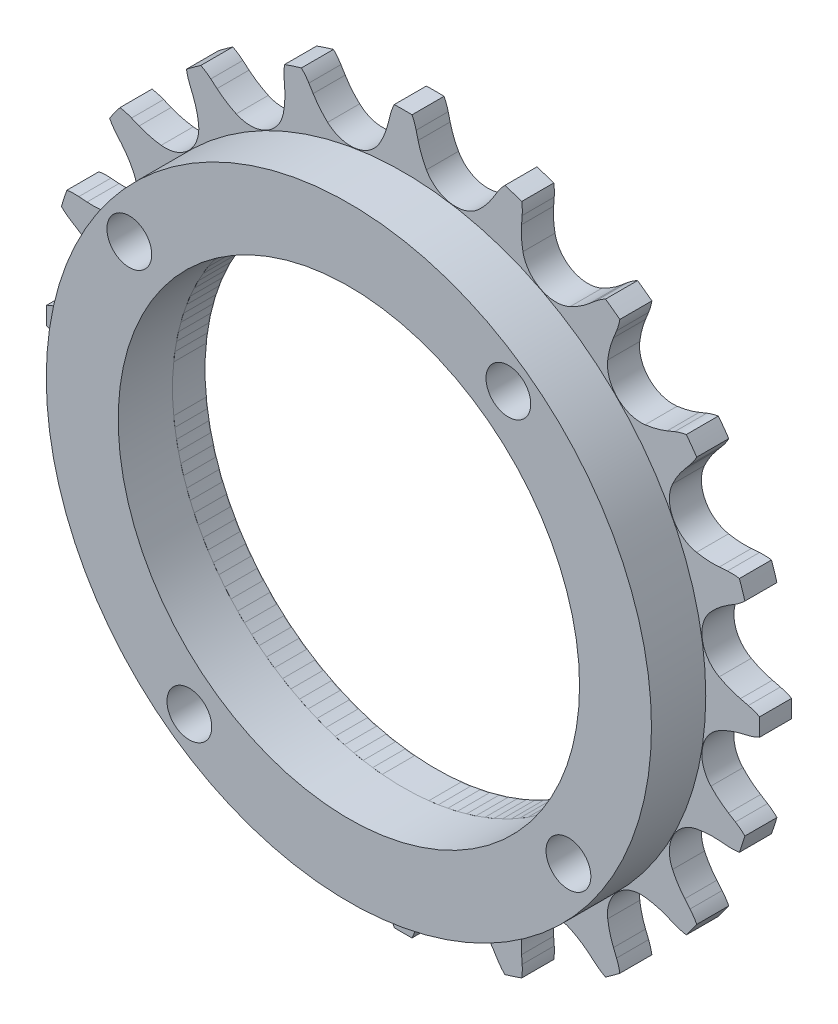
from build123d import *

# Parameters (mm, degrees)
SKETCH1_R           = 6.787119857
BOSS_EXTRUDE1_DEPTH = 2.3622
SKETCH2_R           = 18
BOSS_EXTRUDE2_DEPTH = 2.4
SKETCH3_R           = 17
CUT_EXTRUDE1_DEPTH  = 2.4
SKETCH6_R           = 22.300536673
SKETCH6_R_2         = 17
BOSS_EXTRUDE3_DEPTH = 4
SKETCH5_R           = 1.65
CUT_EXTRUDE3_DEPTH  = 38.700373301


with BuildPart() as part:
    # Sketch1 → Boss-Extrude1 (new body)
    with BuildSketch(Plane.XY.offset(0.25)):
        with BuildLine():
            Line((-24.488227524, 6.948596415), (-23.976513369, 6.631320197))
            ThreePointArc((-23.976513369, 6.631320197), (-23.291994454, 6.141252786), (-22.678303214, 5.564958353))
            ThreePointArc((-22.678303214, 5.564958353), (-22.044379306, 3.491486679), (-23.288014754, 1.715391192))
            ThreePointArc((-23.288014754, 1.715391192), (-24.04975458, 1.356943638), (-24.852209913, 1.102389812))
            Line((-24.852209913, 1.102389812), (-25.436922738, 0.958770568))
            ThreePointArc((-25.436922738, 0.958770568), (-25.860833079, 0.829247508), (-26.267723996, 0.653418098))
            ThreePointArc((-26.267723996, 0.653418098), (-26.275849732, 0), (-26.267723996, -0.653418098))
            ThreePointArc((-26.267723996, -0.653418098), (-25.860833079, -0.829247508), (-25.436922738, -0.958770568))
            Line((-25.436922738, -0.958770568), (-24.852209913, -1.102389812))
            ThreePointArc((-24.852209913, -1.102389812), (-24.04975458, -1.356943638), (-23.288014754, -1.715391192))
            ThreePointArc((-23.288014754, -1.715391192), (-22.044379306, -3.491486679), (-22.678303214, -5.564958353))
            ThreePointArc((-22.678303214, -5.564958353), (-23.291994454, -6.141252786), (-23.976513369, -6.631320197))
            Line((-23.976513369, -6.631320197), (-24.488227524, -6.948596415))
            ThreePointArc((-24.488227524, -6.948596415), (-24.851365389, -7.202775664), (-25.184007371, -7.495735579))
            ThreePointArc((-25.184007371, -7.495735579), (-24.989818108, -8.119684109), (-24.780172778, -8.738610658))
            ThreePointArc((-24.780172778, -8.738610658), (-24.338862244, -8.780098157), (-23.895674726, -8.772286407))
            Line((-23.895674726, -8.772286407), (-23.295198996, -8.728190226))
            ThreePointArc((-23.295198996, -8.728190226), (-22.453357164, -8.722312965), (-21.618133153, -8.827826296))
            ThreePointArc((-21.618133153, -8.827826296), (-19.886521867, -10.132688993), (-19.848681346, -12.300571001))
            ThreePointArc((-19.848681346, -12.300571001), (-20.254251625, -13.0383006), (-20.753828642, -13.715910381))
            Line((-20.753828642, -13.715910381), (-21.14245398, -14.175786366))
            ThreePointArc((-21.14245398, -14.175786366), (-21.409272906, -14.529740969), (-21.635104637, -14.911154431))
            ThreePointArc((-21.635104637, -14.911154431), (-21.257608974, -15.444556964), (-20.866965595, -15.968407121))
            ThreePointArc((-20.866965595, -15.968407121), (-20.434433994, -15.871491623), (-20.01535158, -15.727109732))
            Line((-20.01535158, -15.727109732), (-19.457891694, -15.499614567))
            ThreePointArc((-19.457891694, -15.499614567), (-18.659068707, -15.233881527), (-17.832118057, -15.076132254))
            ThreePointArc((-17.832118057, -15.076132254), (-15.782033111, -15.782033111), (-15.076132254, -17.832118057))
            ThreePointArc((-15.076132254, -17.832118057), (-15.233881527, -18.659068707), (-15.499614567, -19.457891694))
            Line((-15.499614567, -19.457891694), (-15.727109732, -20.01535158))
            ThreePointArc((-15.727109732, -20.01535158), (-15.871491623, -20.434433994), (-15.968407121, -20.866965595))
            ThreePointArc((-15.968407121, -20.866965595), (-15.444556964, -21.257608974), (-14.911154431, -21.635104637))
            ThreePointArc((-14.911154431, -21.635104637), (-14.529740969, -21.409272906), (-14.175786366, -21.14245398))
            Line((-14.175786366, -21.14245398), (-13.715910381, -20.753828642))
            ThreePointArc((-13.715910381, -20.753828642), (-13.0383006, -20.254251625), (-12.300571001, -19.848681346))
            ThreePointArc((-12.300571001, -19.848681346), (-10.132688993, -19.886521867), (-8.827826296, -21.618133153))
            ThreePointArc((-8.827826296, -21.618133153), (-8.722312965, -22.453357164), (-8.728190226, -23.295198996))
            Line((-8.728190226, -23.295198996), (-8.772286407, -23.895674726))
            ThreePointArc((-8.772286407, -23.895674726), (-8.780098157, -24.338862244), (-8.738610658, -24.780172778))
            ThreePointArc((-8.738610658, -24.780172778), (-8.119684109, -24.989818108), (-7.495735579, -25.184007371))
            ThreePointArc((-7.495735579, -25.184007371), (-7.202775664, -24.851365389), (-6.948596415, -24.488227524))
            Line((-6.948596415, -24.488227524), (-6.631320197, -23.976513369))
            ThreePointArc((-6.631320197, -23.976513369), (-6.141252786, -23.291994454), (-5.564958353, -22.678303214))
            ThreePointArc((-5.564958353, -22.678303214), (-3.491486679, -22.044379306), (-1.715391192, -23.288014754))
            ThreePointArc((-1.715391192, -23.288014754), (-1.356943638, -24.04975458), (-1.102389812, -24.852209913))
            Line((-1.102389812, -24.852209913), (-0.958770568, -25.436922738))
            ThreePointArc((-0.958770568, -25.436922738), (-0.829247508, -25.860833079), (-0.653418098, -26.267723996))
            ThreePointArc((-0.653418098, -26.267723996), (0, -26.275849732), (0.653418098, -26.267723996))
            ThreePointArc((0.653418098, -26.267723996), (0.829247508, -25.860833079), (0.958770568, -25.436922738))
            Line((0.958770568, -25.436922738), (1.102389812, -24.852209913))
            ThreePointArc((1.102389812, -24.852209913), (1.356943638, -24.04975458), (1.715391192, -23.288014754))
            ThreePointArc((1.715391192, -23.288014754), (3.491486679, -22.044379306), (5.564958353, -22.678303214))
            ThreePointArc((5.564958353, -22.678303214), (6.141252786, -23.291994454), (6.631320197, -23.976513369))
            Line((6.631320197, -23.976513369), (6.948596415, -24.488227524))
            ThreePointArc((6.948596415, -24.488227524), (7.202775664, -24.851365389), (7.495735579, -25.184007371))
            ThreePointArc((7.495735579, -25.184007371), (8.119684109, -24.989818108), (8.738610658, -24.780172778))
            ThreePointArc((8.738610658, -24.780172778), (8.780098157, -24.338862244), (8.772286407, -23.895674726))
            Line((8.772286407, -23.895674726), (8.728190226, -23.295198996))
            ThreePointArc((8.728190226, -23.295198996), (8.722312965, -22.453357164), (8.827826296, -21.618133153))
            ThreePointArc((8.827826296, -21.618133153), (10.132688993, -19.886521867), (12.300571001, -19.848681346))
            ThreePointArc((12.300571001, -19.848681346), (13.0383006, -20.254251625), (13.715910381, -20.753828642))
            Line((13.715910381, -20.753828642), (14.175786366, -21.14245398))
            ThreePointArc((14.175786366, -21.14245398), (14.529740969, -21.409272906), (14.911154431, -21.635104637))
            ThreePointArc((14.911154431, -21.635104637), (15.444556964, -21.257608974), (15.968407121, -20.866965595))
            ThreePointArc((15.968407121, -20.866965595), (15.871491623, -20.434433994), (15.727109732, -20.01535158))
            Line((15.727109732, -20.01535158), (15.499614567, -19.457891694))
            ThreePointArc((15.499614567, -19.457891694), (15.233881527, -18.659068707), (15.076132254, -17.832118057))
            ThreePointArc((15.076132254, -17.832118057), (15.782033111, -15.782033111), (17.832118057, -15.076132254))
            ThreePointArc((17.832118057, -15.076132254), (18.659068707, -15.233881527), (19.457891694, -15.499614567))
            Line((19.457891694, -15.499614567), (20.01535158, -15.727109732))
            ThreePointArc((20.01535158, -15.727109732), (20.434433994, -15.871491623), (20.866965595, -15.968407121))
            ThreePointArc((20.866965595, -15.968407121), (21.257608974, -15.444556964), (21.635104637, -14.911154431))
            ThreePointArc((21.635104637, -14.911154431), (21.409272906, -14.529740969), (21.14245398, -14.175786366))
            Line((21.14245398, -14.175786366), (20.753828642, -13.715910381))
            ThreePointArc((20.753828642, -13.715910381), (20.254251625, -13.0383006), (19.848681346, -12.300571001))
            ThreePointArc((19.848681346, -12.300571001), (19.886521867, -10.132688993), (21.618133153, -8.827826296))
            ThreePointArc((21.618133153, -8.827826296), (22.453357164, -8.722312965), (23.295198996, -8.728190226))
            Line((23.295198996, -8.728190226), (23.895674726, -8.772286407))
            ThreePointArc((23.895674726, -8.772286407), (24.338862244, -8.780098157), (24.780172778, -8.738610658))
            ThreePointArc((24.780172778, -8.738610658), (24.989818108, -8.119684109), (25.184007371, -7.495735579))
            ThreePointArc((25.184007371, -7.495735579), (24.851365389, -7.202775664), (24.488227524, -6.948596415))
            Line((24.488227524, -6.948596415), (23.976513369, -6.631320197))
            ThreePointArc((23.976513369, -6.631320197), (23.291994454, -6.141252786), (22.678303214, -5.564958353))
            ThreePointArc((22.678303214, -5.564958353), (22.044379306, -3.491486679), (23.288014754, -1.715391192))
            ThreePointArc((23.288014754, -1.715391192), (24.04975458, -1.356943638), (24.852209913, -1.102389812))
            Line((24.852209913, -1.102389812), (25.436922738, -0.958770568))
            ThreePointArc((25.436922738, -0.958770568), (25.860833079, -0.829247508), (26.267723996, -0.653418098))
            ThreePointArc((26.267723996, -0.653418098), (26.275849732, 0), (26.267723996, 0.653418098))
            ThreePointArc((26.267723996, 0.653418098), (25.860833079, 0.829247508), (25.436922738, 0.958770568))
            Line((25.436922738, 0.958770568), (24.852209913, 1.102389812))
            ThreePointArc((24.852209913, 1.102389812), (24.04975458, 1.356943638), (23.288014754, 1.715391192))
            ThreePointArc((23.288014754, 1.715391192), (22.044379306, 3.491486679), (22.678303214, 5.564958353))
            ThreePointArc((22.678303214, 5.564958353), (23.291994454, 6.141252786), (23.976513369, 6.631320197))
            Line((23.976513369, 6.631320197), (24.488227524, 6.948596415))
            ThreePointArc((24.488227524, 6.948596415), (24.851365389, 7.202775664), (25.184007371, 7.495735579))
            ThreePointArc((25.184007371, 7.495735579), (24.989818108, 8.119684109), (24.780172778, 8.738610658))
            ThreePointArc((24.780172778, 8.738610658), (24.338862244, 8.780098157), (23.895674726, 8.772286407))
            Line((23.895674726, 8.772286407), (23.295198996, 8.728190226))
            ThreePointArc((23.295198996, 8.728190226), (22.453357164, 8.722312965), (21.618133153, 8.827826296))
            ThreePointArc((21.618133153, 8.827826296), (19.886521867, 10.132688993), (19.848681346, 12.300571001))
            ThreePointArc((19.848681346, 12.300571001), (20.254251625, 13.0383006), (20.753828642, 13.715910381))
            Line((20.753828642, 13.715910381), (21.14245398, 14.175786366))
            ThreePointArc((21.14245398, 14.175786366), (21.409272906, 14.529740969), (21.635104637, 14.911154431))
            ThreePointArc((21.635104637, 14.911154431), (21.257608974, 15.444556964), (20.866965595, 15.968407121))
            ThreePointArc((20.866965595, 15.968407121), (20.434433994, 15.871491623), (20.01535158, 15.727109732))
            Line((20.01535158, 15.727109732), (19.457891694, 15.499614567))
            ThreePointArc((19.457891694, 15.499614567), (18.659068707, 15.233881527), (17.832118057, 15.076132254))
            ThreePointArc((17.832118057, 15.076132254), (15.782033111, 15.782033111), (15.076132254, 17.832118057))
            ThreePointArc((15.076132254, 17.832118057), (15.233881527, 18.659068707), (15.499614567, 19.457891694))
            Line((15.499614567, 19.457891694), (15.727109732, 20.01535158))
            ThreePointArc((15.727109732, 20.01535158), (15.871491623, 20.434433994), (15.968407121, 20.866965595))
            ThreePointArc((15.968407121, 20.866965595), (15.444556964, 21.257608974), (14.911154431, 21.635104637))
            ThreePointArc((14.911154431, 21.635104637), (14.529740969, 21.409272906), (14.175786366, 21.14245398))
            Line((14.175786366, 21.14245398), (13.715910381, 20.753828642))
            ThreePointArc((13.715910381, 20.753828642), (13.0383006, 20.254251625), (12.300571001, 19.848681346))
            ThreePointArc((12.300571001, 19.848681346), (10.132688993, 19.886521867), (8.827826296, 21.618133153))
            ThreePointArc((8.827826296, 21.618133153), (8.722312965, 22.453357164), (8.728190226, 23.295198996))
            Line((8.728190226, 23.295198996), (8.772286407, 23.895674726))
            ThreePointArc((8.772286407, 23.895674726), (8.780098157, 24.338862244), (8.738610658, 24.780172778))
            ThreePointArc((8.738610658, 24.780172778), (8.119684109, 24.989818108), (7.495735579, 25.184007371))
            ThreePointArc((7.495735579, 25.184007371), (7.202775664, 24.851365389), (6.948596415, 24.488227524))
            Line((6.948596415, 24.488227524), (6.631320197, 23.976513369))
            ThreePointArc((6.631320197, 23.976513369), (6.141252786, 23.291994454), (5.564958353, 22.678303214))
            ThreePointArc((5.564958353, 22.678303214), (3.491486679, 22.044379306), (1.715391192, 23.288014754))
            ThreePointArc((1.715391192, 23.288014754), (1.356943638, 24.04975458), (1.102389812, 24.852209913))
            Line((1.102389812, 24.852209913), (0.958770568, 25.436922738))
            ThreePointArc((0.958770568, 25.436922738), (0.829247508, 25.860833079), (0.653418098, 26.267723996))
            ThreePointArc((0.653418098, 26.267723996), (0, 26.275849732), (-0.653418098, 26.267723996))
            ThreePointArc((-0.653418098, 26.267723996), (-0.829247508, 25.860833079), (-0.958770568, 25.436922738))
            Line((-0.958770568, 25.436922738), (-1.102389812, 24.852209913))
            ThreePointArc((-1.102389812, 24.852209913), (-1.356943638, 24.04975458), (-1.715391192, 23.288014754))
            ThreePointArc((-1.715391192, 23.288014754), (-3.491486679, 22.044379306), (-5.564958353, 22.678303214))
            ThreePointArc((-5.564958353, 22.678303214), (-6.141252786, 23.291994454), (-6.631320197, 23.976513369))
            Line((-6.631320197, 23.976513369), (-6.948596415, 24.488227524))
            ThreePointArc((-6.948596415, 24.488227524), (-7.202775664, 24.851365389), (-7.495735579, 25.184007371))
            ThreePointArc((-7.495735579, 25.184007371), (-8.119684109, 24.989818108), (-8.738610658, 24.780172778))
            ThreePointArc((-8.738610658, 24.780172778), (-8.780098157, 24.338862244), (-8.772286407, 23.895674726))
            Line((-8.772286407, 23.895674726), (-8.728190226, 23.295198996))
            ThreePointArc((-8.728190226, 23.295198996), (-8.722312965, 22.453357164), (-8.827826296, 21.618133153))
            ThreePointArc((-8.827826296, 21.618133153), (-10.132688993, 19.886521867), (-12.300571001, 19.848681346))
            ThreePointArc((-12.300571001, 19.848681346), (-13.0383006, 20.254251625), (-13.715910381, 20.753828642))
            Line((-13.715910381, 20.753828642), (-14.175786366, 21.14245398))
            ThreePointArc((-14.175786366, 21.14245398), (-14.529740969, 21.409272906), (-14.911154431, 21.635104637))
            ThreePointArc((-14.911154431, 21.635104637), (-15.444556964, 21.257608974), (-15.968407121, 20.866965595))
            ThreePointArc((-15.968407121, 20.866965595), (-15.871491623, 20.434433994), (-15.727109732, 20.01535158))
            Line((-15.727109732, 20.01535158), (-15.499614567, 19.457891694))
            ThreePointArc((-15.499614567, 19.457891694), (-15.233881527, 18.659068707), (-15.076132254, 17.832118057))
            ThreePointArc((-15.076132254, 17.832118057), (-15.782033111, 15.782033111), (-17.832118057, 15.076132254))
            ThreePointArc((-17.832118057, 15.076132254), (-18.659068707, 15.233881527), (-19.457891694, 15.499614567))
            Line((-19.457891694, 15.499614567), (-20.01535158, 15.727109732))
            ThreePointArc((-20.01535158, 15.727109732), (-20.434433994, 15.871491623), (-20.866965595, 15.968407121))
            ThreePointArc((-20.866965595, 15.968407121), (-21.257608974, 15.444556964), (-21.635104637, 14.911154431))
            ThreePointArc((-21.635104637, 14.911154431), (-21.409272906, 14.529740969), (-21.14245398, 14.175786366))
            Line((-21.14245398, 14.175786366), (-20.753828642, 13.715910381))
            ThreePointArc((-20.753828642, 13.715910381), (-20.254251625, 13.0383006), (-19.848681346, 12.300571001))
            ThreePointArc((-19.848681346, 12.300571001), (-19.886521867, 10.132688993), (-21.618133153, 8.827826296))
            ThreePointArc((-21.618133153, 8.827826296), (-22.453357164, 8.722312965), (-23.295198996, 8.728190226))
            Line((-23.295198996, 8.728190226), (-23.895674726, 8.772286407))
            ThreePointArc((-23.895674726, 8.772286407), (-24.338862244, 8.780098157), (-24.780172778, 8.738610658))
            ThreePointArc((-24.780172778, 8.738610658), (-24.989818108, 8.119684109), (-25.184007371, 7.495735579))
            ThreePointArc((-25.184007371, 7.495735579), (-24.851365389, 7.202775664), (-24.488227524, 6.948596415))
        make_face()
        Circle(SKETCH1_R, mode=Mode.SUBTRACT)
        with BuildLine():
            Line((6.385503129, 9.127913687), (6.856026394, 9.598436951))
            ThreePointArc((6.856026394, 9.598436951), (9.598436951, 9.598436951), (9.598436951, 6.856026394))
            Line((9.598436951, 6.856026394), (9.127913687, 6.385503129))
            ThreePointArc((9.127913687, 6.385503129), (6.385503129, 6.385503129), (6.385503129, 9.127913687))
        make_face(mode=Mode.SUBTRACT)
        with BuildLine():
            Line((9.127913687, -6.385503129), (9.598436951, -6.856026394))
            ThreePointArc((9.598436951, -6.856026394), (9.598436951, -9.598436951), (6.856026394, -9.598436951))
            Line((6.856026394, -9.598436951), (6.385503129, -9.127913687))
            ThreePointArc((6.385503129, -9.127913687), (6.385503129, -6.385503129), (9.127913687, -6.385503129))
        make_face(mode=Mode.SUBTRACT)
        with BuildLine():
            Line((-6.385503129, -9.127913687), (-6.856026394, -9.598436951))
            ThreePointArc((-6.856026394, -9.598436951), (-9.598436951, -9.598436951), (-9.598436951, -6.856026394))
            Line((-9.598436951, -6.856026394), (-9.127913687, -6.385503129))
            ThreePointArc((-9.127913687, -6.385503129), (-6.385503129, -6.385503129), (-6.385503129, -9.127913687))
        make_face(mode=Mode.SUBTRACT)
        with BuildLine():
            Line((1.939177102, 15.513416816), (1.939177102, 10.96964223))
            ThreePointArc((1.939177102, 10.96964223), (0, 9.030465128), (-1.939177102, 10.96964223))
            Line((-1.939177102, 10.96964223), (-1.939177102, 15.513416816))
            ThreePointArc((-1.939177102, 15.513416816), (0, 17.452593918), (1.939177102, 15.513416816))
        make_face(mode=Mode.SUBTRACT)
        with BuildLine():
            Line((-1.939177102, -15.513416816), (-1.939177102, -10.96964223))
            ThreePointArc((-1.939177102, -10.96964223), (0, -9.030465128), (1.939177102, -10.96964223))
            Line((1.939177102, -10.96964223), (1.939177102, -15.513416816))
            ThreePointArc((1.939177102, -15.513416816), (0, -17.452593918), (-1.939177102, -15.513416816))
        make_face(mode=Mode.SUBTRACT)
        with BuildLine():
            Line((15.513416816, -1.939177102), (10.96964223, -1.939177102))
            ThreePointArc((10.96964223, -1.939177102), (9.030465128, 0), (10.96964223, 1.939177102))
            Line((10.96964223, 1.939177102), (15.513416816, 1.939177102))
            ThreePointArc((15.513416816, 1.939177102), (17.452593918, 0), (15.513416816, -1.939177102))
        make_face(mode=Mode.SUBTRACT)
        with BuildLine():
            Line((-15.513416816, 1.939177102), (-10.96964223, 1.939177102))
            ThreePointArc((-10.96964223, 1.939177102), (-9.030465128, 0), (-10.96964223, -1.939177102))
            Line((-10.96964223, -1.939177102), (-15.513416816, -1.939177102))
            ThreePointArc((-15.513416816, -1.939177102), (-17.452593918, 0), (-15.513416816, 1.939177102))
        make_face(mode=Mode.SUBTRACT)
        with BuildLine():
            Line((-6.856026394, 9.598436951), (-6.385503129, 9.127913687))
            ThreePointArc((-6.385503129, 9.127913687), (-6.385503129, 6.385503129), (-9.127913687, 6.385503129))
            Line((-9.127913687, 6.385503129), (-9.598436951, 6.856026394))
            ThreePointArc((-9.598436951, 6.856026394), (-9.598436951, 9.598436951), (-6.856026394, 9.598436951))
        make_face(mode=Mode.SUBTRACT)
    extrude(amount=-BOSS_EXTRUDE1_DEPTH)


with BuildPart() as body_2:
    # Sketch2 → Boss-Extrude2 (new body)
    with BuildSketch(Plane.XY.offset(0.25)):
        Circle(SKETCH2_R)
    extrude(amount=-BOSS_EXTRUDE2_DEPTH)


with BuildPart() as cut_extrude1_tool:
    # Sketch3 → Cut-Extrude1 (new body)
    with BuildSketch(Plane.XY.offset(0.25)):
        Circle(SKETCH3_R)
    extrude(amount=-CUT_EXTRUDE1_DEPTH)


with BuildPart() as part_1:
    add(part.part)

    # Cut-Extrude1: cut by cut_extrude1_tool
    add(cut_extrude1_tool.part, mode=Mode.SUBTRACT)


with BuildPart() as body_2_1:
    add(body_2.part)

    # Cut-Extrude1: cut by cut_extrude1_tool
    add(cut_extrude1_tool.part, mode=Mode.SUBTRACT)


with BuildPart() as body_3:
    # Sketch6 → Boss-Extrude3 (new body)
    with BuildSketch(Plane.XY.offset(0.25)):
        Circle(SKETCH6_R)
        Circle(SKETCH6_R_2, mode=Mode.SUBTRACT)
    extrude(amount=BOSS_EXTRUDE3_DEPTH)


with BuildPart() as cut_extrude3_tool:
    # Sketch5 → Cut-Extrude3 (new, through all)
    with BuildSketch(Plane(origin=(0, 0, -2.1122), x_dir=(-1, 0, 0), z_dir=(0, 0, -1))):
        with Locations((16.180339887, 11.755705046)):
            Circle(SKETCH5_R)
        with Locations((11.755705046, -16.180339887)):
            Circle(SKETCH5_R)
        with Locations((-16.180339887, -11.755705046)):
            Circle(SKETCH5_R)
        with Locations((-11.755705046, 16.180339887)):
            Circle(SKETCH5_R)
    extrude(amount=-CUT_EXTRUDE3_DEPTH)


with BuildPart() as part_2:
    add(part_1.part)

    # Cut-Extrude3: cut by cut_extrude3_tool
    add(cut_extrude3_tool.part, mode=Mode.SUBTRACT)


with BuildPart() as body_3_1:
    add(body_3.part)

    # Cut-Extrude3: cut by cut_extrude3_tool
    add(cut_extrude3_tool.part, mode=Mode.SUBTRACT)


solid = Compound([body_2_1.part, part_2.part, body_3_1.part])
